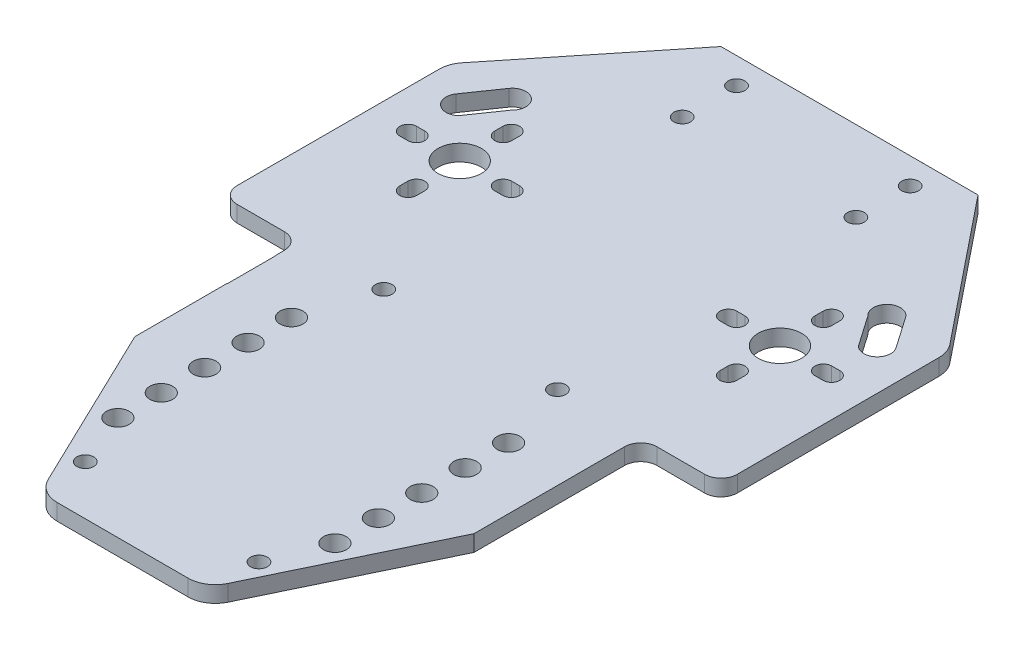
from build123d import *

# Parameters (mm, degrees)
SKETCH1_2_R         = 1.55
SKETCH1_2_R_2       = 2.1
SKETCH1_2_R_3       = 4
EXTRUDE_1_DEPTH     = 3
CUT_EXTRUDE_1_DEPTH = 103.641715784
FILLET_1_R          = 5
FILLET_2_R          = 3
CUT_EXTRUDE_2_DEPTH = 10


with BuildPart() as part:
    # Sketch1<2> → 凸台-拉伸1 (new body)
    with BuildSketch(Plane(origin=(0, 0, 0), x_dir=(1, 0, 0), z_dir=(0, 1, 0))):
        Polygon((46.148756691, -91.633040301), (46, 48.415898807), (-46, 48.415898807), (-46.148704625, -91.584022218), align=None)
        with Locations((-16, -82.5)):
            Circle(SKETCH1_2_R, mode=Mode.SUBTRACT)
        with Locations((-20, -72.5)):
            Circle(SKETCH1_2_R_2, mode=Mode.SUBTRACT)
        with Locations((-20, -64.5)):
            Circle(SKETCH1_2_R_2, mode=Mode.SUBTRACT)
        with BuildLine():
            Line((-31.324560396, -32.437502342), (-31.324560396, -40.532123219))
            ThreePointArc((-31.324560396, -40.532123219), (-34.902584515, -44.110147338), (-38.480608633, -40.532123219))
            Line((-38.480608633, -40.532123219), (-38.480608633, -33.618273202))
            ThreePointArc((-38.480608633, -33.618273202), (-35.598368392, -28.811097573), (-31.324560396, -32.437502342))
        make_face(mode=Mode.SUBTRACT)
        with Locations((-20, -56.5)):
            Circle(SKETCH1_2_R_2, mode=Mode.SUBTRACT)
        with Locations((-20, -48.5)):
            Circle(SKETCH1_2_R_2, mode=Mode.SUBTRACT)
        with Locations((-20, -40.5)):
            Circle(SKETCH1_2_R_2, mode=Mode.SUBTRACT)
        with Locations((-16, -27.5)):
            Circle(SKETCH1_2_R, mode=Mode.SUBTRACT)
        with Locations((16, -82.5)):
            Circle(SKETCH1_2_R, mode=Mode.SUBTRACT)
        with Locations((20, -72.5)):
            Circle(SKETCH1_2_R_2, mode=Mode.SUBTRACT)
        with Locations((20, -64.5)):
            Circle(SKETCH1_2_R_2, mode=Mode.SUBTRACT)
        with Locations((20, -56.5)):
            Circle(SKETCH1_2_R_2, mode=Mode.SUBTRACT)
        with Locations((20, -48.5)):
            Circle(SKETCH1_2_R_2, mode=Mode.SUBTRACT)
        with Locations((20, -40.5)):
            Circle(SKETCH1_2_R_2, mode=Mode.SUBTRACT)
        with Locations((16, -27.5)):
            Circle(SKETCH1_2_R, mode=Mode.SUBTRACT)
        with BuildLine():
            ThreePointArc((38.480608633, -40.532123219), (34.902584515, -44.110147338), (31.324560396, -40.532123219))
            Line((31.324560396, -40.532123219), (31.324560396, -32.437502342))
            ThreePointArc((31.324560396, -32.437502342), (35.598368392, -28.811097573), (38.480608633, -33.618273202))
            Line((38.480608633, -33.618273202), (38.480608633, -40.532123219))
        make_face(mode=Mode.SUBTRACT)
        with BuildLine():
            Line((-31.05, -9.5), (-31.05, -8))
            ThreePointArc((-31.05, -8), (-29.5, -6.45), (-27.95, -8))
            Line((-27.95, -8), (-27.95, -9.5))
            ThreePointArc((-27.95, -9.5), (-29.5, -11.05), (-31.05, -9.5))
        make_face(mode=Mode.SUBTRACT)
        with BuildLine():
            Line((-39, 1.55), (-37.5, 1.55))
            ThreePointArc((-37.5, 1.55), (-35.95, 0), (-37.5, -1.55))
            Line((-37.5, -1.55), (-39, -1.55))
            ThreePointArc((-39, -1.55), (-40.55, 0), (-39, 1.55))
        make_face(mode=Mode.SUBTRACT)
        with BuildLine():
            Line((-32.838354936, 12.874839613), (-36.826644357, 7.122140465))
            ThreePointArc((-36.826644357, 7.122140465), (-40.125878325, 7.09368849), (-40.5284969, 10.368387343))
            Line((-40.5284969, 10.368387343), (-36.540207479, 16.121086492))
            ThreePointArc((-36.540207479, 16.121086492), (-32.870241162, 16.57230252), (-32.838354936, 12.874839613))
        make_face(mode=Mode.SUBTRACT)
        with Locations((-29.5, 0)):
            Circle(SKETCH1_2_R_3, mode=Mode.SUBTRACT)
        with BuildLine():
            Line((-27.95, 9.5), (-27.95, 8))
            ThreePointArc((-27.95, 8), (-29.5, 6.45), (-31.05, 8))
            Line((-31.05, 8), (-31.05, 9.5))
            ThreePointArc((-31.05, 9.5), (-29.5, 11.05), (-27.95, 9.5))
        make_face(mode=Mode.SUBTRACT)
        with BuildLine():
            Line((-20, -1.55), (-21.5, -1.55))
            ThreePointArc((-21.5, -1.55), (-23.05, 0), (-21.5, 1.55))
            Line((-21.5, 1.55), (-20, 1.55))
            ThreePointArc((-20, 1.55), (-18.45, 0), (-20, -1.55))
        make_face(mode=Mode.SUBTRACT)
        with Locations((-16, 27.5)):
            Circle(SKETCH1_2_R, mode=Mode.SUBTRACT)
        with Locations((-16, 37.5)):
            Circle(SKETCH1_2_R, mode=Mode.SUBTRACT)
        with BuildLine():
            ThreePointArc((21.5, 1.55), (23.05, 0), (21.5, -1.55))
            Line((21.5, -1.55), (20, -1.55))
            ThreePointArc((20, -1.55), (18.45, 0), (20, 1.55))
            Line((20, 1.55), (21.5, 1.55))
        make_face(mode=Mode.SUBTRACT)
        with BuildLine():
            ThreePointArc((27.95, -8), (29.5, -6.45), (31.05, -8))
            Line((31.05, -8), (31.05, -9.5))
            ThreePointArc((31.05, -9.5), (29.5, -11.05), (27.95, -9.5))
            Line((27.95, -9.5), (27.95, -8))
        make_face(mode=Mode.SUBTRACT)
        with Locations((29.5, 0)):
            Circle(SKETCH1_2_R_3, mode=Mode.SUBTRACT)
        with BuildLine():
            ThreePointArc((31.05, 8), (29.5, 6.45), (27.95, 8))
            Line((27.95, 8), (27.95, 9.5))
            ThreePointArc((27.95, 9.5), (29.5, 11.05), (31.05, 9.5))
            Line((31.05, 9.5), (31.05, 8))
        make_face(mode=Mode.SUBTRACT)
        with BuildLine():
            ThreePointArc((37.5, -1.55), (35.95, 0), (37.5, 1.55))
            Line((37.5, 1.55), (39, 1.55))
            ThreePointArc((39, 1.55), (40.55, 0), (39, -1.55))
            Line((39, -1.55), (37.5, -1.55))
        make_face(mode=Mode.SUBTRACT)
        with BuildLine():
            ThreePointArc((40.5284969, 10.368387343), (40.125878325, 7.09368849), (36.826644357, 7.122140465))
            Line((36.826644357, 7.122140465), (32.838354936, 12.874839613))
            ThreePointArc((32.838354936, 12.874839613), (32.870241162, 16.57230252), (36.540207479, 16.121086492))
            Line((36.540207479, 16.121086492), (40.5284969, 10.368387343))
        make_face(mode=Mode.SUBTRACT)
        with Locations((16, 27.5)):
            Circle(SKETCH1_2_R, mode=Mode.SUBTRACT)
        with Locations((16, 37.5)):
            Circle(SKETCH1_2_R, mode=Mode.SUBTRACT)
    extrude(amount=EXTRUDE_1_DEPTH)

    # 草图8 → 切除-拉伸1 (cut, through all)
    with BuildSketch(Plane(origin=(0, 0, 0), x_dir=(1, 0, 0), z_dir=(0, 1, 0))):
        Polygon((-60.581160188, -100.138876612), (-11.106907858, -100.138876612), (-31.388896544, -57.980337113), (-31.388896544, -27.441927357), (-46.0805744, -27.441927357), (-60.581160188, 2.69927468), align=None)
        Polygon((11.106907858, -100.138876612), (60.581160188, -100.138876612), (60.581160188, 2.69927468), (46.0805744, -27.441927357), (31.297190757, -27.441927357), (31.297190757, -58.170958562), align=None)
        Polygon((-55.547798239, 53.825279921), (-55.547798239, 2.686584408), (-14.43040337, 53.825279921), align=None)
        Polygon((55.547798239, 2.686584408), (55.547798239, 53.825279921), (14.43040337, 53.825279921), align=None)
    extrude(amount=CUT_EXTRUDE_1_DEPTH, mode=Mode.SUBTRACT)

    # 圆角1
    fillet_1_edges = [part.edges().sort_by_distance(p)[0] for p in [
        (-15.214646295, 1.5, 91.600450928),
        (15.206873585, 1.5, 91.616607436),
        (46.036007008, 1.5, -14.516628531),
        (18.779745038, 1.5, -48.415898807),
        (-18.779745038, 1.5, -48.415898807),
        (-46.036007008, 1.5, -14.516628531),
    ]]
    fillet(fillet_1_edges, radius=FILLET_1_R)

    # 圆角2
    fillet_2_edges = [part.edges().sort_by_distance(p)[0] for p in [
        (-46.0805744, 1.5, 27.441927357),
        (-31.388896544, 1.5, 27.441927357),
        (31.297190757, 1.5, 27.441927357),
        (46.0805744, 1.5, 27.441927357),
    ]]
    fillet(fillet_2_edges, radius=FILLET_2_R)

    # 草图9 → 切除-拉伸2 (cut)
    with BuildSketch(Plane.XZ):
        Polygon((-6.766487961, -48.415898807), (-21.353451928, -48.415898807), (-23.680890499, -42.32022601), (23.680890499, -42.32022601), (18.779745038, -48.415898807), align=None)
    extrude(amount=-CUT_EXTRUDE_2_DEPTH, mode=Mode.SUBTRACT)


solid = part.part
